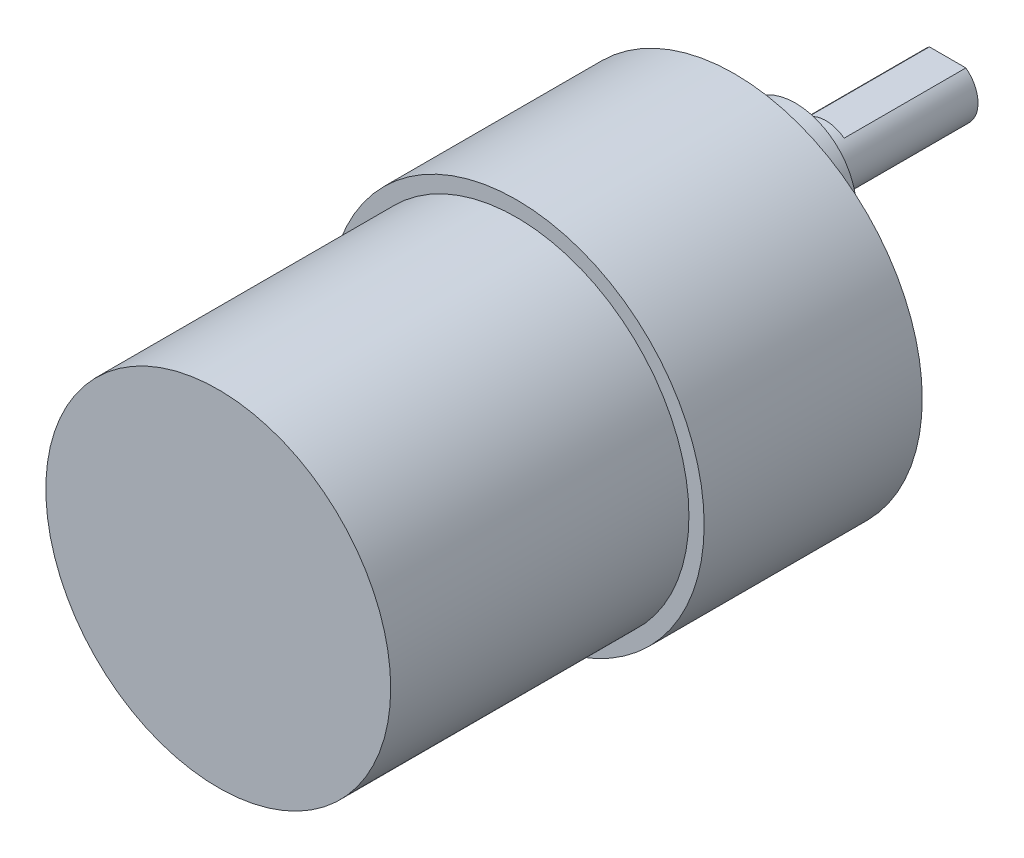
from build123d import *

# Parameters (mm, degrees)
SKETCH_1_R          = 18.5
EXTRUDE_1_DEPTH     = 21.5
SKETCH_2_R          = 17
EXTRUDE_2_DEPTH     = 29.4
CUT_EXTRUDE_1_DEPTH = 1
SKETCH_4_R          = 6
EXTRUDE_3_DEPTH     = 6
SKETCH_5_R          = 3
EXTRUDE_4_DEPTH     = 15
CUT_EXTRUDE_START   = -12
CUT_EXTRUDE_2_DEPTH = 12
SKETCH_7_R          = 1.5
CUT_EXTRUDE_3_DEPTH = 5
SKETCH_8_R          = 2
CUT_EXTRUDE_4_DEPTH = 1


with BuildPart() as part:
    # 草图1 → 凸台-拉伸1 (new body)
    with BuildSketch(Plane.XY):
        Circle(SKETCH_1_R)
    extrude(amount=EXTRUDE_1_DEPTH)

    # 草图2 → 凸台-拉伸2 (add)
    with BuildSketch(Plane.XY.offset(21.5)):
        Circle(SKETCH_2_R)
    extrude(amount=EXTRUDE_2_DEPTH)

    # 草图3 → 切除-拉伸1 (cut)
    with BuildSketch(Plane(origin=(0, 0, 0), x_dir=(-1, 0, 0), z_dir=(0, 0, -1))):
        with BuildLine():
            ThreePointArc((11.36051163, 5.214285714), (0, -4.5), (-11.36051163, 5.214285714))
            ThreePointArc((-11.36051163, 5.214285714), (0, -12.5), (11.36051163, 5.214285714))
        make_face()
    extrude(amount=-CUT_EXTRUDE_1_DEPTH, mode=Mode.SUBTRACT)

    # 草图4 → 凸台-拉伸3 (add)
    with BuildSketch(Plane(origin=(0, 0, 0), x_dir=(-1, 0, 0), z_dir=(0, 0, -1))):
        with Locations((0, 7)):
            Circle(SKETCH_4_R)
    extrude(amount=EXTRUDE_3_DEPTH)

    # 草图5 → 凸台-拉伸4 (add)
    with BuildSketch(Plane(origin=(0, 0, -6), x_dir=(-1, 0, 0), z_dir=(0, 0, -1))):
        with Locations((0, 7)):
            Circle(SKETCH_5_R)
    extrude(amount=EXTRUDE_4_DEPTH)

    # 草图6 → 切除-拉伸2 (cut)
    with BuildSketch(Plane(origin=(0, 0, -21), x_dir=(-1, 0, 0), z_dir=(0, 0, -1)).offset(CUT_EXTRUDE_START)):
        with BuildLine():
            Line((0, 9.4), (1.8, 9.4))
            ThreePointArc((1.8, 9.4), (0, 10), (-1.8, 9.4))
            Line((-1.8, 9.4), (0, 9.4))
        make_face()
    extrude(amount=CUT_EXTRUDE_2_DEPTH, mode=Mode.SUBTRACT)

    # 草图7 → 切除-拉伸3 (cut)
    with BuildSketch(Plane(origin=(0, 0, 0), x_dir=(-1, 0, 0), z_dir=(0, 0, -1))):
        with Locations((15.5, 0)):
            Circle(SKETCH_7_R)
        with Locations((-15.5, 0)):
            Circle(SKETCH_7_R)
        with Locations((-7.75, -13.423393759)):
            Circle(SKETCH_7_R)
        with Locations((7.75, 13.423393759)):
            Circle(SKETCH_7_R)
        with Locations((-7.75, 13.423393759)):
            Circle(SKETCH_7_R)
        with Locations((7.75, -13.423393759)):
            Circle(SKETCH_7_R)
    extrude(amount=-CUT_EXTRUDE_3_DEPTH, mode=Mode.SUBTRACT)

    # 草图8 → 切除-拉伸4 (cut)
    with BuildSketch(Plane(origin=(0, 0, 0), x_dir=(-1, 0, 0), z_dir=(0, 0, -1))):
        with Locations((0, -15.5)):
            Circle(SKETCH_8_R)
        with Locations((-13.423393759, 7.75)):
            Circle(SKETCH_8_R)
        with Locations((13.423393759, 7.75)):
            Circle(SKETCH_8_R)
    extrude(amount=-CUT_EXTRUDE_4_DEPTH, mode=Mode.SUBTRACT)


solid = part.part
